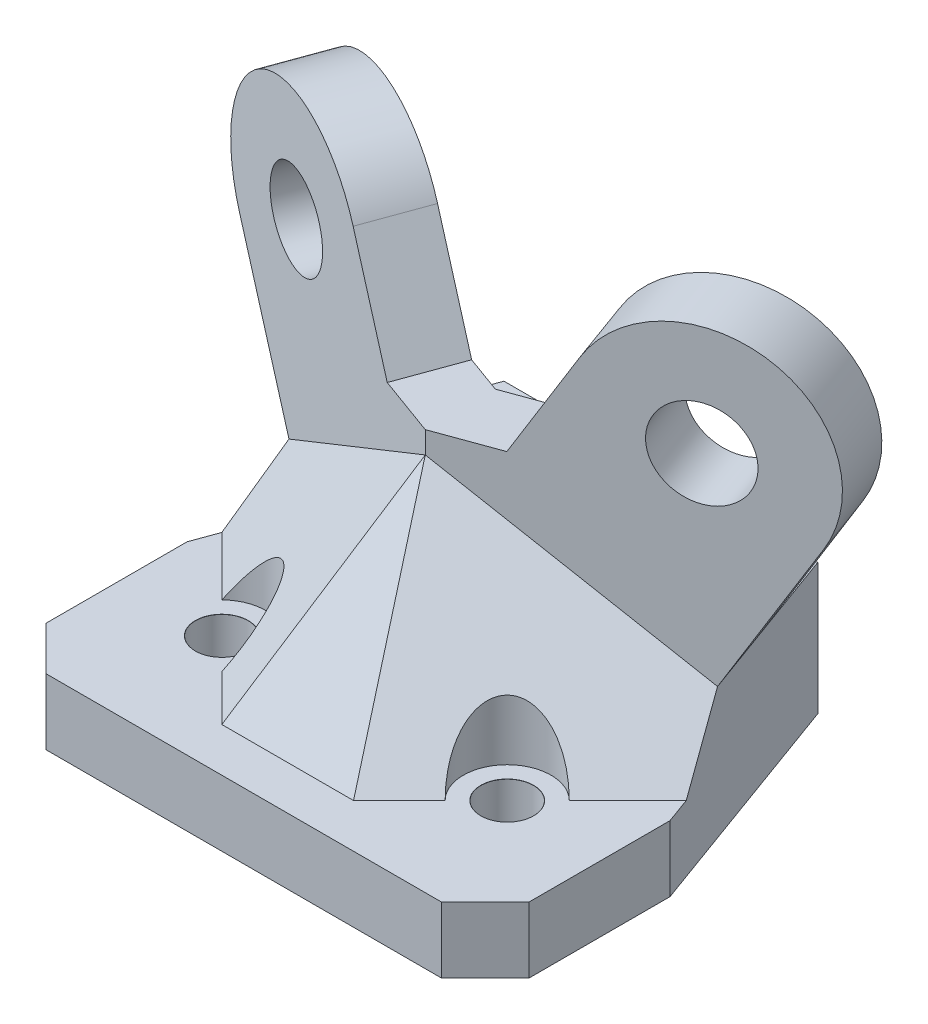
from build123d import *

# Parameters (mm, degrees)
SKETCH1_W                           = 110
SKETCH1_H                           = 95
BOSS_EXTRUDE1_DEPTH                 = 15
SKETCH6_R                           = 25
SKETCH6_R_2                         = 10
BOSS_EXTRUDE7_DEPTH                 = 15
DELETEFACE4_START                   = 15
DELETEFACE4_DEPTH                   = 50
CUT_EXTRUDE1_DEPTH                  = 29.85315
BOSS_EXTRUDE8_DEPTH                 = 14.85315
F_12_0_12_DIAMETER_HOLE1_AT_2_COUNT = 2
F_12_0_12_DIAMETER_HOLE1_AT_2_PITCH = 65
SKETCH17_R                          = 10
CUT_EXTRUDE2_DEPTH                  = 15
CHAMFER1_SIZE                       = 10


# Read off the part's stored shape, not the designer's step: DeleteFace4
with BuildPart() as part:
    # Sketch1 → Boss-Extrude1 (new body)
    with BuildSketch(Plane(origin=(0, 0, 0), x_dir=(1, 0, 0), z_dir=(0, 1, 0))):
        with Locations((0, 47.5)):
            Rectangle(SKETCH1_W, SKETCH1_H)
    extrude(amount=BOSS_EXTRUDE1_DEPTH)

    # Sketch6 → Boss-Extrude7 (add)
    # profile 1 of 3: a face of its own
    with BuildSketch(Plane(origin=(-46.172719349, 75, -58.141496194), x_dir=(0.9396926207859081, 0, 0.34202014332566977), z_dir=(-0.3420201433256697, 0, 0.939692620785908))):
        Circle(SKETCH6_R)
        Circle(SKETCH6_R_2, mode=Mode.SUBTRACT)
    # profile 2 of 3: a face of its own
    with BuildSketch(Plane(origin=(-46.172719349, 75, -58.141496194), x_dir=(0.9396926207859081, 0, 0.34202014332566977), z_dir=(-0.3420201433256697, 0, 0.939692620785908))):
        with BuildLine():
            ThreePointArc((25, 0), (6.470476128, -24.148145657), (-21.650635095, -12.5))
            Line((-21.650635095, -12.5), (5.773502692, -60))
            Line((5.773502692, -60), (63.508529611, -60))
            Line((63.508529611, -60), (34.641016151, -10))
            Line((34.641016151, -10), (21.650635095, 12.5))
            ThreePointArc((21.650635095, 12.5), (24.148145657, 6.470476128), (25, 0))
        make_face()
    # profile 3 of 3: a face of its own
    with BuildSketch(Plane(origin=(-46.172719349, 75, -58.141496194), x_dir=(0.9396926207859081, 0, 0.34202014332566977), z_dir=(-0.3420201433256697, 0, 0.939692620785908))):
        Polygon((34.641016151, -10), (63.508529611, -60), (84.985310553, -60), (84.985310553, -10), align=None)
    boss_extrude7 = extrude(amount=-BOSS_EXTRUDE7_DEPTH)

    # Mirror1: Boss-Extrude7 across plane
    add(boss_extrude7.mirror(Plane(origin=(0, 0, 0), x_dir=(0, 0, 1), z_dir=(1, 0, 0))))

    # DeleteFace4 outline → DeleteFace4 (cut)
    with BuildSketch(Plane(origin=(0, 0, 0), x_dir=(1, 0, 0), z_dir=(0, 1, 0)).offset(DELETEFACE4_START)):
        Polygon((21.928533001, 49.317334009), (0, 41.336000716), (33.687349853, 29.074808098), (38.817652003, 43.17019741), align=None)
        Polygon((0, 41.336000716), (-21.928533001, 49.317334009), (-38.817652003, 43.17019741), (-33.687349853, 29.074808098), align=None)
    extrude(amount=DELETEFACE4_DEPTH, mode=Mode.SUBTRACT)

    # Sketch8 → Loft1 section 0
    with BuildSketch(Plane(origin=(0, 15, 0), x_dir=(1, 0, 0), z_dir=(0, 1, 0)), mode=Mode.PRIVATE) as loft1_s0:
        with BuildLine():
            Line((-15, 10), (15, 10))
            Line((15, 10), (72.85193746, 67.85193746))
            Line((72.85193746, 67.85193746), (0, 41.336000716))
            Line((0, 41.336000716), (-72.85193746, 67.85193746))
            Line((-72.85193746, 67.85193746), (-15, 10))
        make_face()
    loft([Vertex(0, 60, -41.336000716), loft1_s0.sketch])

    # Sketch13 → Cut-Extrude1 (cut)
    with BuildSketch(Plane(origin=(0, 0, 0), x_dir=(1, 0, 0), z_dir=(0, 1, 0))):
        Polygon((-55, 95), (-55, 42.081139662), (-35.739110006, 95), align=None)
    extrude(amount=CUT_EXTRUDE1_DEPTH, mode=Mode.SUBTRACT)


with BuildPart() as cut_extrude1_kept_piece:
    # of the separate pieces the step leaves, the one the design keeps (cut_extrude1_pieces_kept)
    add(part.part.solids().sort_by_distance((-55, 0, 0))[0])

    # Sketch14 → Boss-Extrude8 (add)
    with BuildSketch(Plane(origin=(0, 15, 0), x_dir=(1, 0, 0), z_dir=(0, 1, 0))):
        Polygon((0, 57.298667303), (0, 95), (-35.739110006, 95), (-48.805705227, 59.099824681), (-40.747401473, 56.166841976), (-35.617099323, 70.262231288), align=None)
    extrude(amount=BOSS_EXTRUDE8_DEPTH)

    # SurfaceCut2
    split(bisect_by=Plane(origin=(0, 0, 0), x_dir=(0, 0, -1), z_dir=(1, 0, 0)), keep=Keep.BOTTOM)

    # Mirror3: Cut-Extrude1 kept piece across plane


with BuildPart() as cut_extrude1_kept_piece_1:
    add(cut_extrude1_kept_piece.part)
    add(cut_extrude1_kept_piece.part.mirror(Plane(origin=(0, 0, 0), x_dir=(0, 0, 1), z_dir=(1, 0, 0))))

    # Sketch16 → Ø12.0 (12) Diameter Hole1 (revolve, cut)
    with BuildSketch(Plane(origin=(32.5, 15, -27.5), x_dir=(0, 0, 1), z_dir=(1, 0, 0))):
        Polygon((0, 0), (0, 15), (6, 15), (6, 0.025), (6.025, 0), align=None)
    f_12_0_12_diameter_hole1 = revolve(axis=Axis((32.5, 21.35, -27.5), (0, -1, 0)), mode=Mode.SUBTRACT)

    # Ø12.0 (12) Diameter Hole1 at 2: Ø12.0 (12) Diameter Hole1 ×2
    with Locations(*[(-i * F_12_0_12_DIAMETER_HOLE1_AT_2_PITCH, 0, 0) for i in range(1, F_12_0_12_DIAMETER_HOLE1_AT_2_COUNT)]):
        add(f_12_0_12_diameter_hole1, mode=Mode.SUBTRACT)

    # Sketch17 → Cut-Extrude2 (cut)
    with BuildSketch(Plane(origin=(0, 15, 0), x_dir=(1, 0, 0), z_dir=(0, 1, 0))):
        with Locations((-32.5, 27.5)):
            Circle(SKETCH17_R)
        with Locations((32.5, 27.5)):
            Circle(SKETCH17_R)
    extrude(amount=CUT_EXTRUDE2_DEPTH, mode=Mode.SUBTRACT)

    # Chamfer1
    chamfer1_edges = [cut_extrude1_kept_piece_1.edges().sort_by_distance(p)[0] for p in [
        (-55, 7.5, 0),
        (55, 7.5, 0),
    ]]
    chamfer(chamfer1_edges, length=CHAMFER1_SIZE)


solid = cut_extrude1_kept_piece_1.part
